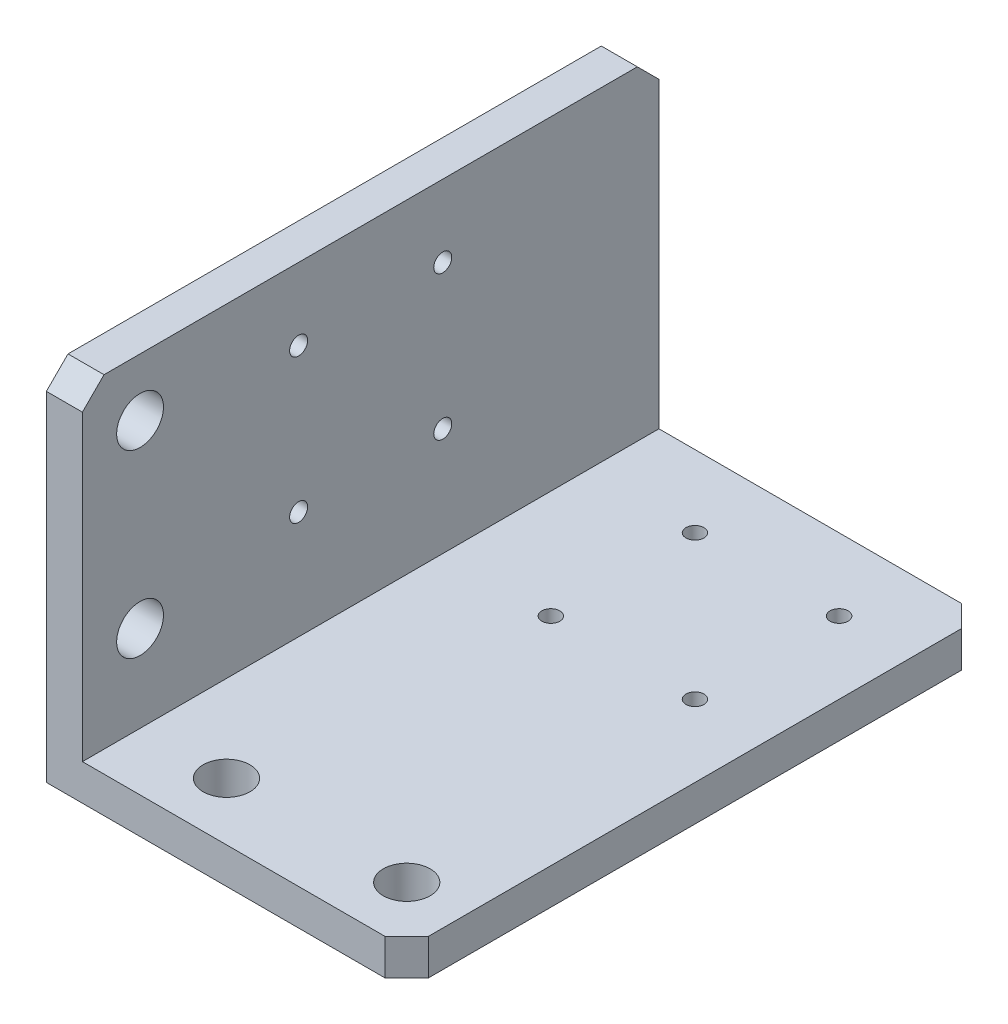
from build123d import *

# Parameters (mm, degrees)
ESTRUSIONE_ESTRUSIONE1_DEPTH = 80
FORO_6_5_6_5_1_D             = 6.5
FORO_6_5_6_5_2_D             = 6.5
FORO_6_5_6_5_2_DEPTH         = 5
FORO_6_5_6_5_2_TIP           = 1.952797012
SMUSSO1_SIZE                 = 3
M3_TAPPED_HOLE1_D            = 2.5
M3_TAPPED_HOLE2_D            = 2.5


with BuildPart() as part:
    # Schizzo1 → Estrusione-Estrusione1 (new body)
    with BuildSketch(Plane.XY):
        Polygon((0, 0), (0, 50), (5, 50), (5, 5), (50, 5), (50, 0), align=None)
    extrude(amount=ESTRUSIONE_ESTRUSIONE1_DEPTH)

    # Foro Ø6.5 (6.5)-1 (through all)
    with Locations(Plane(origin=(0, 0, 0), x_dir=(-1, 0, 0), z_dir=(0, -1, 0))):
        with Locations((-17, -72), (-42, -72)):
            Hole(FORO_6_5_6_5_1_D / 2)

    # Foro Ø6.5 (6.5)-2
    with Locations(Plane.ZY):
        with Locations((72, 42), (72, 17)):
            Hole(FORO_6_5_6_5_2_D / 2, depth=FORO_6_5_6_5_2_DEPTH)
            with Locations((0, 0, -(FORO_6_5_6_5_2_DEPTH + FORO_6_5_6_5_2_TIP / 2))):  # 118° drill point
                Cone(0, FORO_6_5_6_5_2_D / 2, FORO_6_5_6_5_2_TIP, mode=Mode.SUBTRACT)

    # Smusso1
    smusso1_edges = [part.edges().sort_by_distance(p)[0] for p in [
        (2.5, 50, 0),
        (50, 2.5, 0),
        (50, 2.5, 80),
        (2.5, 50, 80),
    ]]
    chamfer(smusso1_edges, length=SMUSSO1_SIZE)

    # M3 Tapped Hole1 (through all)
    with Locations(Plane(origin=(20, 0, 30), x_dir=(-1, 0, 0), z_dir=(0, -1, 0))):
        with Locations((0, 0), (-20, 0), (-20, 20), (0, 20)):
            Hole(M3_TAPPED_HOLE1_D / 2)

    # M3 Tapped Hole2 (through all)
    with Locations(Plane(origin=(0, 40, 30), x_dir=(0, 0, -1), z_dir=(-1, 0, 0))):
        with Locations((0, 0), (-20, 0), (-20, 20), (0, 20)):
            Hole(M3_TAPPED_HOLE2_D / 2)


solid = part.part
